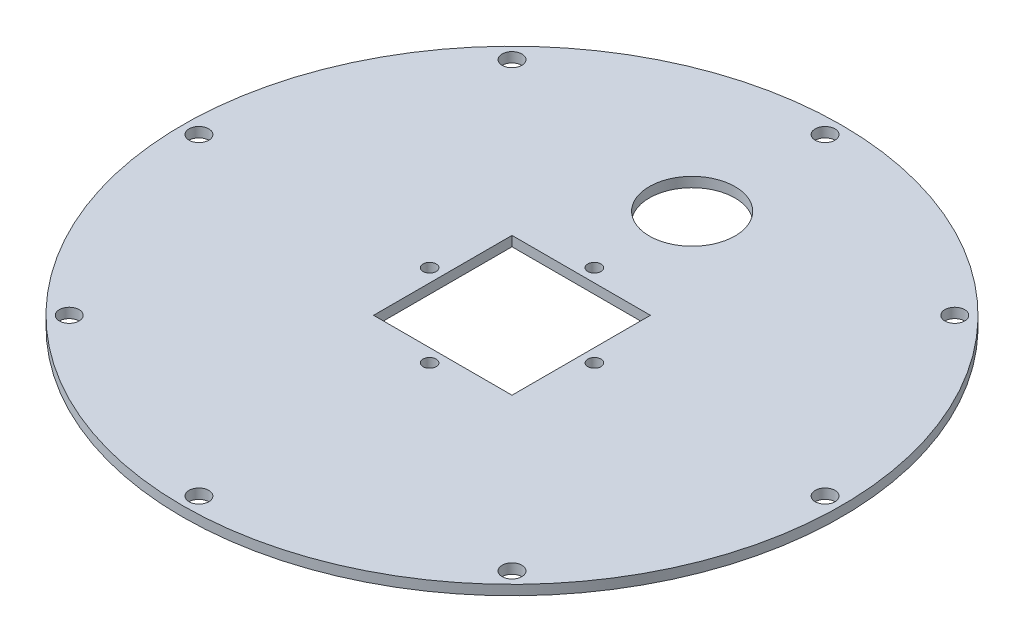
from build123d import *

# Parameters (mm, degrees)
EXTRUDE_1_OUTLINE_R   = 100
EXTRUDE_1_OUTLINE_R_2 = 3
EXTRUDE_1_OUTLINE_W   = 42
EXTRUDE_1_OUTLINE_H   = 42
EXTRUDE_1_DEPTH       = 3
SKETCH_2_R            = 13
SKETCH_2_R_2          = 2
CUT_EXTRUDE_1_DEPTH   = 3


# Read off the part's stored shape, not the designer's step: Бобышка-Вытянуть1
with BuildPart() as part:
    # Бобышка-Вытянуть1 outline → Бобышка-Вытянуть1 (new body)
    with BuildSketch(Plane(origin=(0, 0, 0), x_dir=(1, 0, 0), z_dir=(0, 1, 0))):
        Circle(EXTRUDE_1_OUTLINE_R)
        with Locations((-67.175120484, -67.175120484)):
            Circle(EXTRUDE_1_OUTLINE_R_2, mode=Mode.SUBTRACT)
        with Locations((0, -95)):
            Circle(EXTRUDE_1_OUTLINE_R_2, mode=Mode.SUBTRACT)
        with Locations((67.175120484, -67.175120484)):
            Circle(EXTRUDE_1_OUTLINE_R_2, mode=Mode.SUBTRACT)
        with Locations((-95, 0)):
            Circle(EXTRUDE_1_OUTLINE_R_2, mode=Mode.SUBTRACT)
        with Locations((-67.175120484, 67.175120484)):
            Circle(EXTRUDE_1_OUTLINE_R_2, mode=Mode.SUBTRACT)
        Rectangle(EXTRUDE_1_OUTLINE_W, EXTRUDE_1_OUTLINE_H, mode=Mode.SUBTRACT)
        with Locations((95, 0)):
            Circle(EXTRUDE_1_OUTLINE_R_2, mode=Mode.SUBTRACT)
        with Locations((0, 95)):
            Circle(EXTRUDE_1_OUTLINE_R_2, mode=Mode.SUBTRACT)
        with Locations((67.175120484, 67.175120484)):
            Circle(EXTRUDE_1_OUTLINE_R_2, mode=Mode.SUBTRACT)
    extrude(amount=EXTRUDE_1_DEPTH)

    # Эскиз2 → Вырез-Вытянуть1 (cut)
    with BuildSketch(Plane(origin=(0, 3, 0), x_dir=(1, 0, 0), z_dir=(0, 1, 0))):
        with Locations(Location((0, 54.663461451, 0), (0, 0, 270))):
            Circle(SKETCH_2_R)
        with Locations(Location((25, 0, 0), (0, 0, 270))):
            Circle(SKETCH_2_R_2)
        with Locations(Location((0, 25, 0), (0, 0, 270))):
            Circle(SKETCH_2_R_2)
        with Locations(Location((-25, 0, 0), (0, 0, 270))):
            Circle(SKETCH_2_R_2)
        with Locations(Location((0, -25, 0), (0, 0, 270))):
            Circle(SKETCH_2_R_2)
    extrude(amount=-CUT_EXTRUDE_1_DEPTH, mode=Mode.SUBTRACT)


solid = part.part
